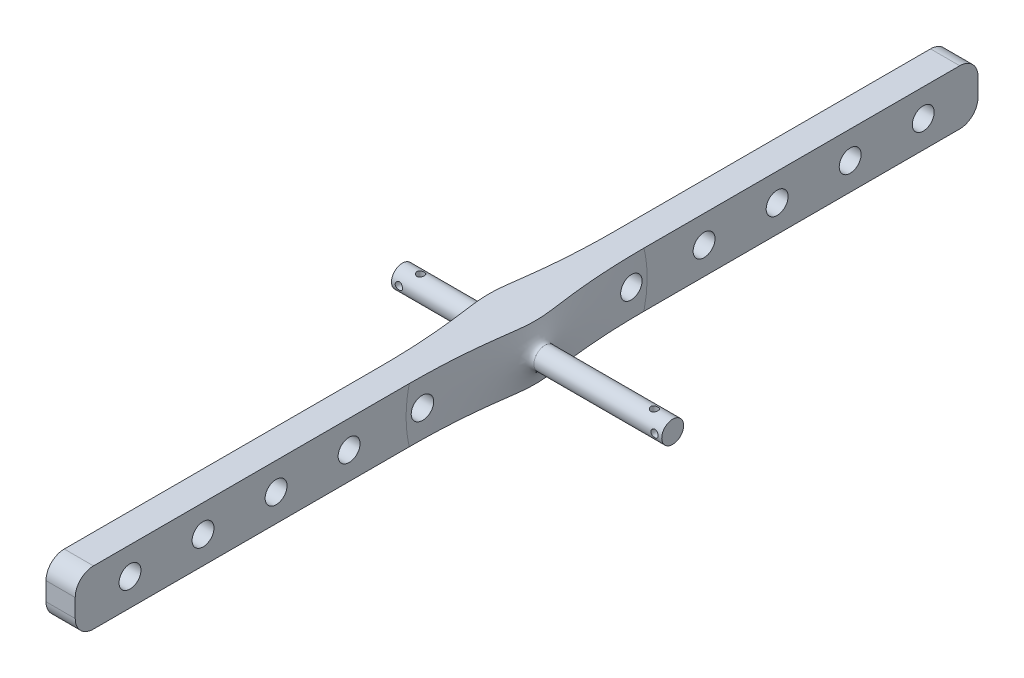
from build123d import *

# Parameters (mm, degrees)
SKETCH_1_W           = 130
SKETCH_1_H           = 15
EXTRUDE_1_DEPTH      = 8
EXTRUDE_5_DEPTH      = 26
EXTRUDE_5_DEPTH_BACK = 48
SKETCH_15_R          = 3
CUT_EXTRUDE_9_REACH  = 141.388
SKETCH_16_R          = 1
CUT_EXTRUDE_10_REACH = 141.388
SKETCH_17_R          = 3
SKETCH_18_R          = 1
CUT_EXTRUDE_11_DEPTH = 15
SKETCH_19_W          = 8
SKETCH_19_H          = 15
EXTRUDE_6_DEPTH      = 117.2
FILLET_1_R           = 5
FILLET_2_SIZE        = 30
FILLET_2_SIZE_2      = 5
FILLET_3_SIZE        = 30
FILLET_3_SIZE_2      = 5


with BuildPart() as part:
    # 草图1 → 凸台-拉伸1 (new body)
    with BuildSketch(Plane(origin=(0, 0, 0), x_dir=(0, 0, -1), z_dir=(1, 0, 0))):
        with Locations((65, 7.5)):
            Rectangle(SKETCH_1_W, SKETCH_1_H)
    extrude(amount=EXTRUDE_1_DEPTH)

    # 草图15 → 凸台-拉伸5 (add, two sides: drawn at the far end of the back side and taken through both)
    with BuildSketch(Plane.ZY.offset(-EXTRUDE_5_DEPTH_BACK)):
        with Locations((-6.4, 7.5)):
            Circle(SKETCH_15_R)
    extrude(amount=EXTRUDE_5_DEPTH + EXTRUDE_5_DEPTH_BACK)

    # 草图16 → 切除-拉伸9 (cut, up to next)
    with BuildSketch(Plane.XY, mode=Mode.PRIVATE) as cut_extrude_9_sk1:
        with Locations((-24, 7.5)):
            Circle(SKETCH_16_R)
    cut_extrude_9_tool1 = extrude(cut_extrude_9_sk1.sketch, amount=-CUT_EXTRUDE_9_REACH, mode=Mode.PRIVATE) & part.part
    # 草图16 → 切除-拉伸9 (cut, up to next)
    with BuildSketch(Plane.XY, mode=Mode.PRIVATE) as cut_extrude_9_sk2:
        with Locations((46, 7.5)):
            Circle(SKETCH_16_R)
    cut_extrude_9_tool2 = extrude(cut_extrude_9_sk2.sketch, amount=-CUT_EXTRUDE_9_REACH, mode=Mode.PRIVATE) & part.part
    add(cut_extrude_9_tool1.solids().sort_by_distance((-24, 7.5, 0))[0], mode=Mode.SUBTRACT)
    add(cut_extrude_9_tool2.solids().sort_by_distance((46, 7.5, 0))[0], mode=Mode.SUBTRACT)

    # 草图17 → 切除-拉伸10 (cut, up to next)
    with BuildSketch(Plane.ZY, mode=Mode.PRIVATE) as cut_extrude_10_sk1:
        with Locations((-115, 7.5)):
            Circle(SKETCH_17_R)
    cut_extrude_10_tool1 = extrude(cut_extrude_10_sk1.sketch, amount=-CUT_EXTRUDE_10_REACH, mode=Mode.PRIVATE) & part.part
    # 草图17 → 切除-拉伸10 (cut, up to next)
    with BuildSketch(Plane.ZY, mode=Mode.PRIVATE) as cut_extrude_10_sk2:
        with Locations((-95, 7.5)):
            Circle(SKETCH_17_R)
    cut_extrude_10_tool2 = extrude(cut_extrude_10_sk2.sketch, amount=-CUT_EXTRUDE_10_REACH, mode=Mode.PRIVATE) & part.part
    # 草图17 → 切除-拉伸10 (cut, up to next)
    with BuildSketch(Plane.ZY, mode=Mode.PRIVATE) as cut_extrude_10_sk3:
        with Locations((-75, 7.5)):
            Circle(SKETCH_17_R)
    cut_extrude_10_tool3 = extrude(cut_extrude_10_sk3.sketch, amount=-CUT_EXTRUDE_10_REACH, mode=Mode.PRIVATE) & part.part
    # 草图17 → 切除-拉伸10 (cut, up to next)
    with BuildSketch(Plane.ZY, mode=Mode.PRIVATE) as cut_extrude_10_sk4:
        with Locations((-55, 7.5)):
            Circle(SKETCH_17_R)
    cut_extrude_10_tool4 = extrude(cut_extrude_10_sk4.sketch, amount=-CUT_EXTRUDE_10_REACH, mode=Mode.PRIVATE) & part.part
    # 草图17 → 切除-拉伸10 (cut, up to next)
    with BuildSketch(Plane.ZY, mode=Mode.PRIVATE) as cut_extrude_10_sk5:
        with Locations((-35, 7.5)):
            Circle(SKETCH_17_R)
    cut_extrude_10_tool5 = extrude(cut_extrude_10_sk5.sketch, amount=-CUT_EXTRUDE_10_REACH, mode=Mode.PRIVATE) & part.part
    cut_extrude_10_1 = cut_extrude_10_tool1.solids().sort_by_distance((0, 7.5, -115))[0]
    add(cut_extrude_10_1, mode=Mode.SUBTRACT)
    cut_extrude_10_2 = cut_extrude_10_tool2.solids().sort_by_distance((0, 7.5, -95))[0]
    add(cut_extrude_10_2, mode=Mode.SUBTRACT)
    cut_extrude_10_3 = cut_extrude_10_tool3.solids().sort_by_distance((0, 7.5, -75))[0]
    add(cut_extrude_10_3, mode=Mode.SUBTRACT)
    cut_extrude_10_4 = cut_extrude_10_tool4.solids().sort_by_distance((0, 7.5, -55))[0]
    add(cut_extrude_10_4, mode=Mode.SUBTRACT)
    cut_extrude_10_5 = cut_extrude_10_tool5.solids().sort_by_distance((0, 7.5, -35))[0]
    add(cut_extrude_10_5, mode=Mode.SUBTRACT)
    cut_extrude_10 = cut_extrude_10_1 + cut_extrude_10_2 + cut_extrude_10_3 + cut_extrude_10_4 + cut_extrude_10_5  # 切除-拉伸10 as one shape, for the pattern or mirror that repeats it

    # 草图18 → 切除-拉伸11 (cut)
    with BuildSketch(Plane(origin=(0, 0, 0), x_dir=(1, 0, 0), z_dir=(0, 1, 0))):
        with Locations(Location((-21, 6.4, 0), (0, 0, 90))):
            Circle(SKETCH_18_R)
        with Locations(Location((43, 6.4, 0), (0, 0, 90))):
            Circle(SKETCH_18_R)
    extrude(amount=CUT_EXTRUDE_11_DEPTH, mode=Mode.SUBTRACT)

    # 草图19 → 凸台-拉伸6 (add)
    with BuildSketch(Plane.XY):
        with Locations((4, 7.5)):
            Rectangle(SKETCH_19_W, SKETCH_19_H)
    extrude(amount=EXTRUDE_6_DEPTH)

    # 镜向1: 切除-拉伸10 across plane
    add(cut_extrude_10.mirror(Plane.XY.offset(-6.4)), mode=Mode.SUBTRACT)

    # 圆角1
    fillet_1_edges = [part.edges().sort_by_distance(p)[0] for p in [
        (4, 0, 117.2),
        (4, 15, 117.2),
        (4, 15, -130),
        (4, 0, -130),
    ]]
    fillet(fillet_1_edges, radius=FILLET_1_R)

    # 圆角2
    # an asymmetric fillet: 30, 5 mm, written as the material it adds along each edge
    with BuildSketch(Plane(origin=(0, 7.5, -6.4), x_dir=(0, 0, 1), z_dir=(0, -1, 0))) as fillet_2_piece_1_section:
        with BuildLine():
            Bezier((3 + FILLET_2_SIZE, 0), (3, 0), (3, FILLET_2_SIZE_2), weights=[1, 0.707106781, 1])
            Line((3, FILLET_2_SIZE_2), (3, 0))
            Line((3, 0), (3 + FILLET_2_SIZE, 0))
        make_face()
    fillet_2_piece_1 = revolve(axis=Axis((0, 7.5, -6.4), (-1, 0, 0)), mode=Mode.PRIVATE)
    fillet_2_piece_1 = split(fillet_2_piece_1, bisect_by=Plane(origin=(-1.348225674, 0, -18.167423161), z_dir=(0, 1, 0)), keep=Keep.TOP, mode=Mode.PRIVATE)
    fillet_2_piece_1 = split(fillet_2_piece_1, bisect_by=Plane(origin=(-1.348225674, 15, -18.167423161), z_dir=(0, -1, 0)), keep=Keep.TOP, mode=Mode.PRIVATE)
    fillet_2_piece_1 = fillet_2_piece_1 - Plane(origin=(-1.348225674, 7.5, 22.2), x_dir=(0, 0, -1), z_dir=(-1, 0, 0)) * Cylinder(3, 132, mode=Mode.PRIVATE)
    fillet_2_piece_1 = fillet_2_piece_1 - Plane(origin=(-1.348225674, 7.5, -35), x_dir=(0, 0, 1), z_dir=(-1, 0, 0)) * Cylinder(3, 132, mode=Mode.PRIVATE)
    add(fillet_2_piece_1)

    # 圆角3
    # an asymmetric fillet: 30, 5 mm, written as the material it adds along each edge
    with BuildSketch(Plane(origin=(8, 7.5, -6.4), x_dir=(0, 0, 1), z_dir=(0, -1, 0))) as fillet_3_piece_1_section:
        with BuildLine():
            Bezier((3 + FILLET_3_SIZE, 0), (3, 0), (3, -FILLET_3_SIZE_2), weights=[1, 0.707106781, 1])
            Line((3, -FILLET_3_SIZE_2), (3, 0))
            Line((3, 0), (3 + FILLET_3_SIZE, 0))
        make_face()
    fillet_3_piece_1 = revolve(axis=Axis((8, 7.5, -6.4), (-1, 0, 0)), mode=Mode.PRIVATE)
    fillet_3_piece_1 = fillet_3_piece_1 - Plane(origin=(9.348225685, 7.5, -35), x_dir=(0, 0, 1), z_dir=(-1, 0, 0)) * Cylinder(3, 132, mode=Mode.PRIVATE)
    fillet_3_piece_1 = split(fillet_3_piece_1, bisect_by=Plane(origin=(9.348225685, 0, -18.167423163), z_dir=(0, 1, 0)), keep=Keep.TOP, mode=Mode.PRIVATE)
    fillet_3_piece_1 = split(fillet_3_piece_1, bisect_by=Plane(origin=(9.348225685, 15, -18.167423163), z_dir=(0, -1, 0)), keep=Keep.TOP, mode=Mode.PRIVATE)
    fillet_3_piece_1 = fillet_3_piece_1 - Plane(origin=(9.348225685, 7.5, 22.2), x_dir=(0, 0, -1), z_dir=(-1, 0, 0)) * Cylinder(3, 132, mode=Mode.PRIVATE)
    add(fillet_3_piece_1)


solid = part.part
